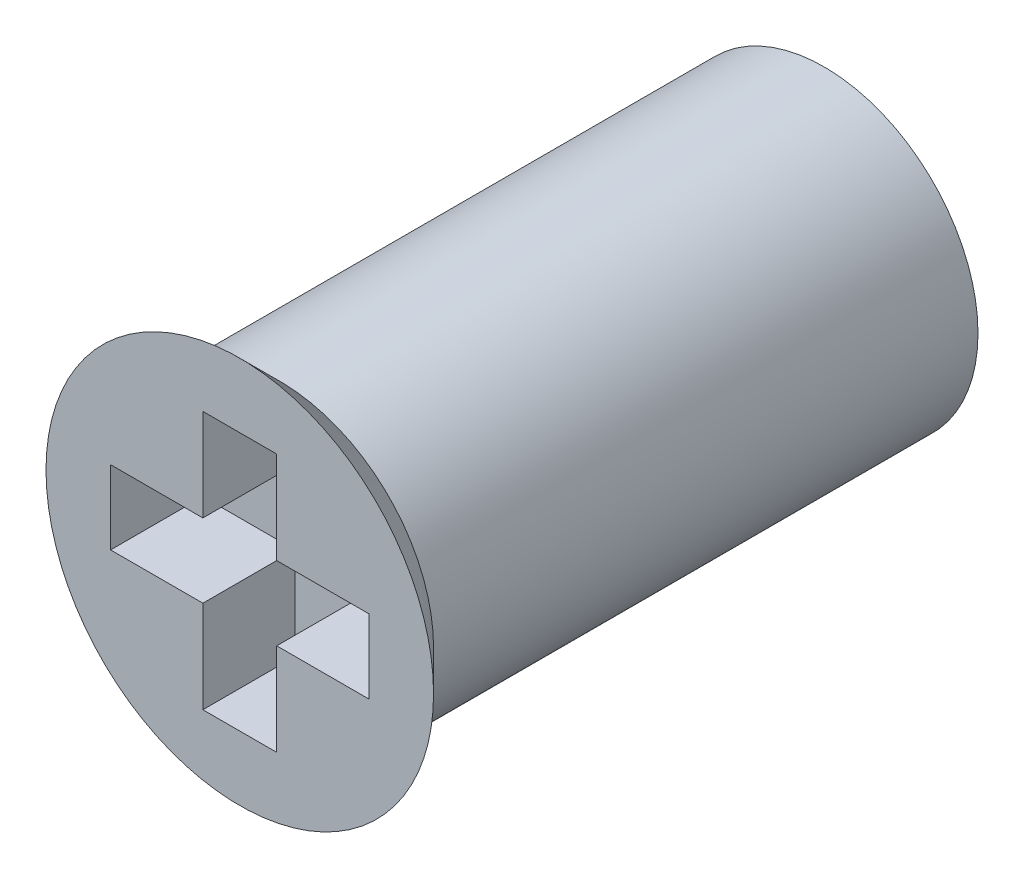
from build123d import *

# Parameters (mm, degrees)
ESQUISSE1_R             = 2.5
BOSS_EXTRU_1_DEPTH      = 8
ESQUISSE2_R             = 3.15
BOSS_EXTRU_2_DEPTH      = 1.5
CHANFREIN1_SIZE         = 1.5
ENL_V_MAT_EXTRU_1_DEPTH = 1.5


with BuildPart() as part:
    # Esquisse1 → Boss.-Extru.1 (new body)
    with BuildSketch(Plane.XY):
        Circle(ESQUISSE1_R)
    extrude(amount=BOSS_EXTRU_1_DEPTH)

    # Esquisse2 → Boss.-Extru.2 (add)
    with BuildSketch(Plane.XY.offset(8)):
        Circle(ESQUISSE2_R)
    extrude(amount=BOSS_EXTRU_2_DEPTH)

    # Chanfrein1
    # the kernel refuses this chamfer: 1.5 mm, written as the material it takes off along each edge
    with BuildSketch(Plane(origin=(0, 0, 8), x_dir=(1, 0, 0), z_dir=(0, -1, 0))) as chanfrein1_piece_1_section:
        Polygon((3.15, CHANFREIN1_SIZE), (3.15 - CHANFREIN1_SIZE, 0), (3.15, 0), align=None)
    chanfrein1_piece_1 = revolve(axis=Axis((0, 0, 8), (0, 0, 1)), mode=Mode.PRIVATE)
    chanfrein1_piece_1 = chanfrein1_piece_1 - Plane(origin=(0, 0, 9.178723354), x_dir=(1, 0, 0), z_dir=(0, 0, -1)) * Cylinder(2.5, 13, mode=Mode.PRIVATE)
    add(chanfrein1_piece_1, mode=Mode.SUBTRACT)

    # Esquisse3 → Enlèv. mat.-Extru.1 (cut)
    with BuildSketch(Plane.XY.offset(9.5)):
        Polygon((-0.6, 2.1), (0.6, 2.1), (0.6, 0.6), (2.1, 0.6), (2.1, -0.6), (0.6, -0.6), (0.6, -2.1), (-0.6, -2.1), (-0.6, -0.6), (-2.1, -0.6), (-2.1, 0.6), (-0.6, 0.6), align=None)
    extrude(amount=-ENL_V_MAT_EXTRU_1_DEPTH, mode=Mode.SUBTRACT)


solid = part.part
